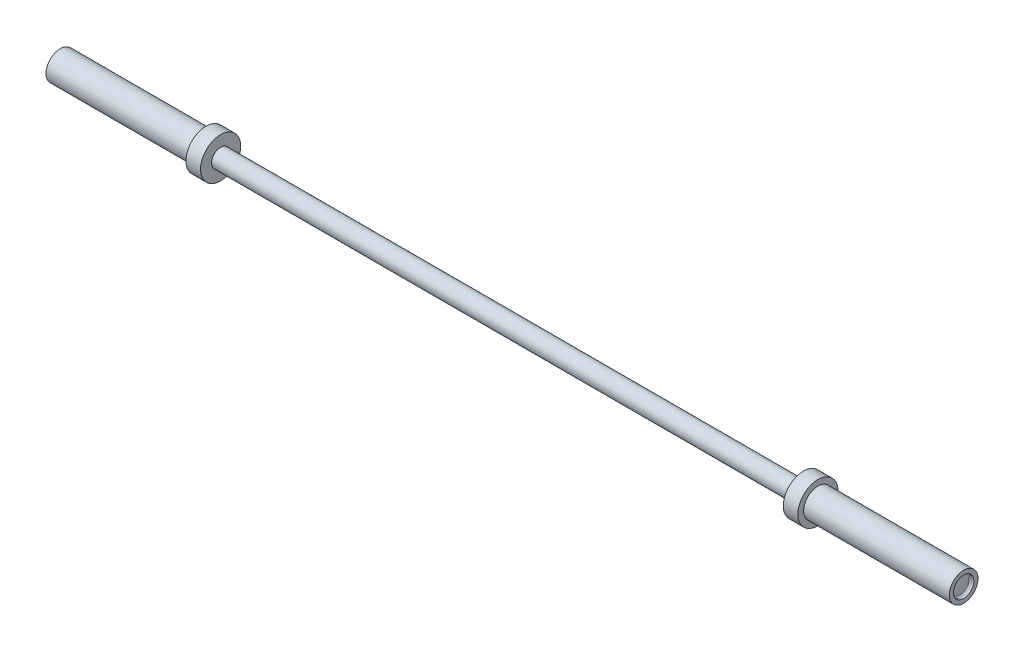
from build123d import *

# Parameters (mm, degrees)
SKETCH1_R           = 15.875
BOSS_EXTRUDE1_DEPTH = 1016
SKETCH2_R           = 34.999999977
BOSS_EXTRUDE2_DEPTH = 25.4
BOSS_EXTRUDE3_START = 25.4
SKETCH3_R           = 34.999999977
BOSS_EXTRUDE3_DEPTH = 25.4
SKETCH4_R           = 25
BOSS_EXTRUDE4_DEPTH = 254
BOSS_EXTRUDE5_START = 254
SKETCH5_R           = 25
BOSS_EXTRUDE5_DEPTH = 254
SKETCH6_R           = 17.78
CUT_EXTRUDE1_DEPTH  = 6.35
CUT_EXTRUDE2_START  = -6.35
SKETCH7_R           = 17.78
CUT_EXTRUDE2_DEPTH  = 6.35
FILLET1_R           = 2.54


with BuildPart() as part:
    # Sketch1 → Boss-Extrude1 (new body)
    with BuildSketch(Plane(origin=(0, 0, 0), x_dir=(0, 0, -1), z_dir=(1, 0, 0))):
        Circle(SKETCH1_R)
    extrude(amount=BOSS_EXTRUDE1_DEPTH)

    # Sketch2 → Boss-Extrude2 (add)
    with BuildSketch(Plane(origin=(1016, 0, 0), x_dir=(0, 0, -1), z_dir=(1, 0, 0))):
        Circle(SKETCH2_R)
    extrude(amount=BOSS_EXTRUDE2_DEPTH)

    # Sketch3 → Boss-Extrude3 (add)
    with BuildSketch(Plane.ZY.offset(BOSS_EXTRUDE3_START)):
        Circle(SKETCH3_R)
    extrude(amount=-BOSS_EXTRUDE3_DEPTH)

    # Sketch4 → Boss-Extrude4 (add)
    with BuildSketch(Plane(origin=(1041.4, 0, 0), x_dir=(0, 0, -1), z_dir=(1, 0, 0))):
        Circle(SKETCH4_R)
    extrude(amount=BOSS_EXTRUDE4_DEPTH)

    # Sketch5 → Boss-Extrude5 (add)
    with BuildSketch(Plane.ZY.offset(25.4).offset(BOSS_EXTRUDE5_START)):
        Circle(SKETCH5_R)
    extrude(amount=-BOSS_EXTRUDE5_DEPTH)

    # Sketch6 → Cut-Extrude1 (cut)
    with BuildSketch(Plane.ZY.offset(279.4)):
        Circle(SKETCH6_R)
    extrude(amount=-CUT_EXTRUDE1_DEPTH, mode=Mode.SUBTRACT)

    # Sketch7 → Cut-Extrude2 (cut)
    with BuildSketch(Plane(origin=(1295.4, 0, 0), x_dir=(0, 0, -1), z_dir=(1, 0, 0)).offset(CUT_EXTRUDE2_START)):
        Circle(SKETCH7_R)
    extrude(amount=CUT_EXTRUDE2_DEPTH, mode=Mode.SUBTRACT)

    # Fillet1
    fillet1_edges = [part.edges().sort_by_distance(p)[0] for p in [
        (1289.05, 0, 17.78),
        (-273.05, 0, -17.78),
    ]]
    fillet(fillet1_edges, radius=FILLET1_R)


solid = part.part
